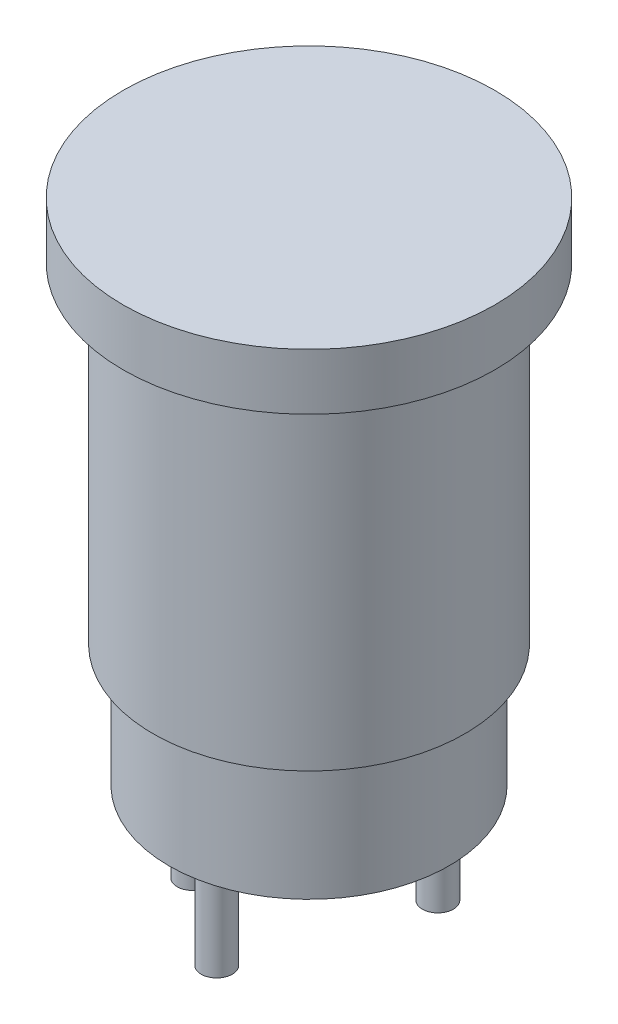
from build123d import *

# Parameters (mm, degrees)
SKETCH2_R           = 0.635
BOSS_EXTRUDE1_DEPTH = 4.5
CIRPATTERN1_COUNT   = 4
CIRPATTERN1_ANGLE   = 216


with BuildPart() as part:
    # Sketch1 → Revolve1 (revolve)
    with BuildSketch(Plane.XY):
        Polygon((0, 0), (7.6, 0), (7.6, -2.3), (6.375, -2.3), (6.375, -15.8), (5.728350463, -15.8), (5.728350463, -20.8), (0, -20.8), align=None)
    revolve(axis=Axis((0, -20.8, 0), (0, 1, 0)))

    # Sketch2 → Boss-Extrude1 (add)
    with BuildSketch(Plane.XZ.offset(20.8)):
        with Locations((0, 3.773128742)):
            Circle(SKETCH2_R)
    boss_extrude1 = extrude(amount=BOSS_EXTRUDE1_DEPTH)

    # CirPattern1: Boss-Extrude1 ×4 about axis
    cirpattern1_axis = Axis((0, -20.8, 0), (0, -1, 0))
    for i in range(1, CIRPATTERN1_COUNT):
        add(boss_extrude1.rotate(cirpattern1_axis, i * CIRPATTERN1_ANGLE / (CIRPATTERN1_COUNT - 1)))


solid = part.part
